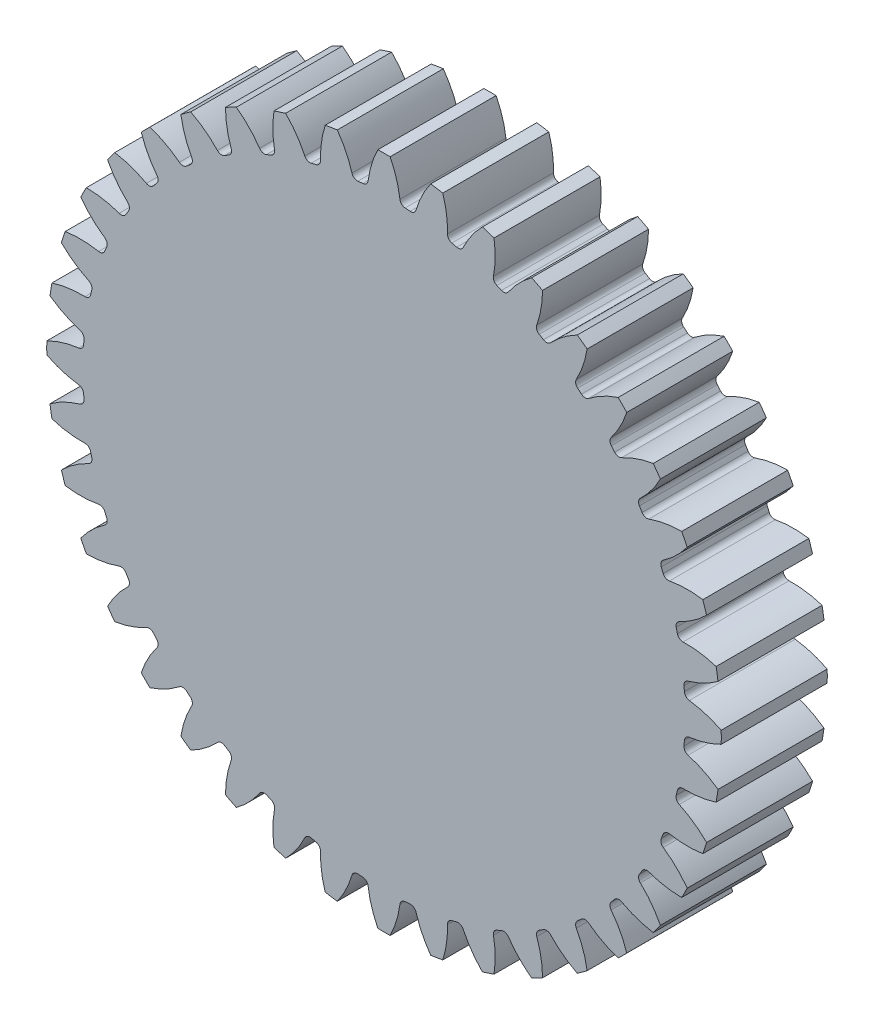
from build123d import *

# Parameters (mm, degrees)
ESQUISSE1_R                        = 1.15
BASE_EXTRUSION_DEPTH               = 2.5
BOSS_EXTRU_1_DEPTH                 = 3.3
CONG_1_R                           = 0.175
R_P_TITION_CIRCULAIRE4_COUNT       = 40
CONG_1_OF_R_P_TITION_CIRCULAIRE4_R = 0.175


with BuildPart() as part:
    # Esquisse1 → Base-Extrusion (new body)
    with BuildSketch(Plane.XY):
        Circle(ESQUISSE1_R)
    extrude(amount=BASE_EXTRUSION_DEPTH)

    # Esquisse3 → Boss.-Extru.1 (add)
    with BuildSketch(Plane.XY):
        with BuildLine():
            Line((-0.735554022, 9.346100004), (0, 0))
            Line((0, 0), (0.735554022, 9.346100004))
            ThreePointArc((0.735554022, 9.346100004), (0.62314708, 9.354267086), (0.510650079, 9.361082282))
            ThreePointArc((0.510650079, 9.361082282), (0.406217794, 9.945410374), (0.190155724, 10.498277992))
            ThreePointArc((0.190155724, 10.498277992), (0, 10.5), (-0.190155724, 10.498277992))
            ThreePointArc((-0.190155724, 10.498277992), (-0.406217794, 9.945410374), (-0.510650079, 9.361082282))
            ThreePointArc((-0.510650079, 9.361082282), (-0.62314708, 9.354267086), (-0.735554022, 9.346100004))
        make_face()
    boss_extru_1 = extrude(amount=BOSS_EXTRU_1_DEPTH)

    # Congé1
    cong_1_edges = [part.edges().sort_by_distance(p)[0] for p in [
        (0.510650079, 9.361082282, 1.65),
        (-0.510650079, 9.361082282, 1.65),
    ]]
    fillet(cong_1_edges, radius=CONG_1_R)

    # Répétition circulaire4: Boss.-Extru.1 ×40 about axis
    r_p_tition_circulaire4_axis = Axis((0, 0, 53.3), (0, 0, -1))
    for i in range(1, R_P_TITION_CIRCULAIRE4_COUNT):
        add(boss_extru_1.rotate(r_p_tition_circulaire4_axis, i * 360 / R_P_TITION_CIRCULAIRE4_COUNT))

    # Congé1 of Répétition circulaire4
    cong_1_of_r_p_tition_circulaire4_edges = [part.edges().sort_by_distance(p)[0] for p in [
        (1.968759028, 9.165948554, 1.65),
        (0.96003277, 9.325715098, 1.65),
        (3.378390596, 8.745118752, 1.65),
        (2.407076426, 9.060717857, 1.65),
        (4.704834975, 8.108955102, 1.65),
        (3.794849871, 8.572615672, 1.65),
        (5.915430703, 7.273122067, 1.65),
        (5.089181519, 7.873427238, 1.65),
        (6.980368895, 6.258200627, 1.65),
        (6.258200627, 6.980368895, 1.65),
        (7.873427238, 5.089181519, 1.65),
        (7.273122067, 5.915430703, 1.65),
        (8.572615672, 3.794849871, 1.65),
        (8.108955102, 4.704834975, 1.65),
        (9.060717857, 2.407076426, 1.65),
        (8.745118752, 3.378390596, 1.65),
        (9.325715098, 0.96003277, 1.65),
        (9.165948554, 1.968759028, 1.65),
        (9.361082282, -0.510650079, 1.65),
        (9.361082282, 0.510650079, 1.65),
        (9.165948554, -1.968759028, 1.65),
        (9.325715098, -0.96003277, 1.65),
        (8.745118752, -3.378390596, 1.65),
        (9.060717857, -2.407076426, 1.65),
        (8.108955102, -4.704834975, 1.65),
        (8.572615672, -3.794849871, 1.65),
        (7.273122067, -5.915430703, 1.65),
        (7.873427238, -5.089181519, 1.65),
        (6.258200627, -6.980368895, 1.65),
        (6.980368895, -6.258200627, 1.65),
        (5.089181519, -7.873427238, 1.65),
        (5.915430703, -7.273122067, 1.65),
        (3.794849871, -8.572615672, 1.65),
        (4.704834975, -8.108955102, 1.65),
        (2.407076426, -9.060717857, 1.65),
        (3.378390596, -8.745118752, 1.65),
        (0.96003277, -9.325715098, 1.65),
        (1.968759028, -9.165948554, 1.65),
        (-0.510650079, -9.361082282, 1.65),
        (0.510650079, -9.361082282, 1.65),
        (-1.968759028, -9.165948554, 1.65),
        (-0.96003277, -9.325715098, 1.65),
        (-3.378390596, -8.745118752, 1.65),
        (-2.407076426, -9.060717857, 1.65),
        (-4.704834975, -8.108955102, 1.65),
        (-3.794849871, -8.572615672, 1.65),
        (-5.915430703, -7.273122067, 1.65),
        (-5.089181519, -7.873427238, 1.65),
        (-6.980368895, -6.258200627, 1.65),
        (-6.258200627, -6.980368895, 1.65),
        (-7.873427238, -5.089181519, 1.65),
        (-7.273122067, -5.915430703, 1.65),
        (-8.572615672, -3.794849871, 1.65),
        (-8.108955102, -4.704834975, 1.65),
        (-9.060717857, -2.407076426, 1.65),
        (-8.745118752, -3.378390596, 1.65),
        (-9.325715098, -0.96003277, 1.65),
        (-9.165948554, -1.968759028, 1.65),
        (-9.361082282, 0.510650079, 1.65),
        (-9.361082282, -0.510650079, 1.65),
        (-9.165948554, 1.968759028, 1.65),
        (-9.325715098, 0.96003277, 1.65),
        (-8.745118752, 3.378390596, 1.65),
        (-9.060717857, 2.407076426, 1.65),
        (-8.108955102, 4.704834975, 1.65),
        (-8.572615672, 3.794849871, 1.65),
        (-7.273122067, 5.915430703, 1.65),
        (-7.873427238, 5.089181519, 1.65),
        (-6.258200627, 6.980368895, 1.65),
        (-6.980368895, 6.258200627, 1.65),
        (-5.089181519, 7.873427238, 1.65),
        (-5.915430703, 7.273122067, 1.65),
        (-3.794849871, 8.572615672, 1.65),
        (-4.704834975, 8.108955102, 1.65),
        (-2.407076426, 9.060717857, 1.65),
        (-3.378390596, 8.745118752, 1.65),
        (-0.96003277, 9.325715098, 1.65),
        (-1.968759028, 9.165948554, 1.65),
    ]]
    fillet(cong_1_of_r_p_tition_circulaire4_edges, radius=CONG_1_OF_R_P_TITION_CIRCULAIRE4_R)


solid = part.part
